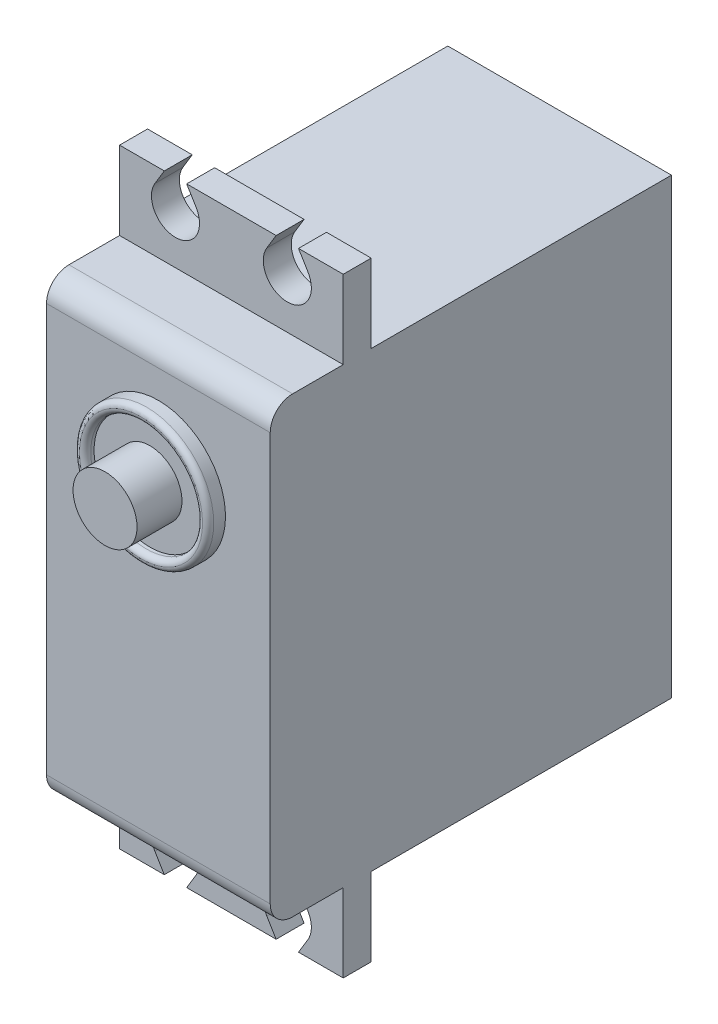
from build123d import *

# Parameters (mm, degrees)
BOSS_EXTRUDE1_DEPTH = 10
SKETCH3_R           = 2.15
CUT_EXTRUDE2_DEPTH  = 2.5
SKETCH2_R           = 6
BOSS_EXTRUDE2_DEPTH = 1.55
CUT_EXTRUDE1_START  = 1.55
CUT_EXTRUDE1_DEPTH  = 0.8
SKETCH2_4_R         = 2.86
BOSS_EXTRUDE3_DEPTH = 4.77
FILLET1_R           = 0.5


with BuildPart() as part:
    # Sketch1 → Boss-Extrude1 (new, symmetric)
    with BuildSketch(Plane(origin=(0, 0, 0), x_dir=(0, 0, -1), z_dir=(1, 0, 0))):
        with BuildLine():
            Line((35.88, -20.25), (35.88, 20.25))
            Line((35.88, 20.25), (9.03, 20.25))
            Line((9.03, 20.25), (9.03, 27.25))
            Line((9.03, 27.25), (6.53, 27.25))
            Line((6.53, 27.25), (6.53, 20.25))
            Line((6.53, 20.25), (2, 20.25))
            ThreePointArc((2, 20.25), (0.585786438, 19.664213562), (0, 18.25))
            Line((0, 18.25), (0, -18.25))
            ThreePointArc((0, -18.25), (0.585786438, -19.664213562), (2, -20.25))
            Line((2, -20.25), (6.53, -20.25))
            Line((6.53, -20.25), (6.53, -27.25))
            Line((6.53, -27.25), (9.03, -27.25))
            Line((9.03, -27.25), (9.03, -20.25))
            Line((9.03, -20.25), (35.88, -20.25))
        make_face()
    extrude(amount=BOSS_EXTRUDE1_DEPTH, both=True)

    # Sketch3 → Cut-Extrude2 (cut)
    with BuildSketch(Plane.XY.offset(-6.53)):
        with Locations((-5, 24.75)):
            Circle(SKETCH3_R)
        with BuildLine():
            Line((-6, 27.25), (-6.839329825, 25.86326807))
            ThreePointArc((-6.839329825, 25.86326807), (-5, 26.9), (-3.160670175, 25.86326807))
            Line((-3.160670175, 25.86326807), (-4, 27.25))
            Line((-4, 27.25), (-6, 27.25))
        make_face()
        with Locations((5, 24.75)):
            Circle(SKETCH3_R)
        with BuildLine():
            Line((6, 27.25), (4, 27.25))
            Line((4, 27.25), (3.160670175, 25.86326807))
            ThreePointArc((3.160670175, 25.86326807), (5, 26.9), (6.839329825, 25.86326807))
            Line((6.839329825, 25.86326807), (6, 27.25))
        make_face()
    cut_extrude2 = extrude(amount=-CUT_EXTRUDE2_DEPTH, mode=Mode.SUBTRACT)

    # Sketch2 → Boss-Extrude2 (add)
    with BuildSketch(Plane.XY):
        with Locations(Location((0, 9.75, 0), (0, 0, 90))):
            Circle(SKETCH2_R)
    extrude(amount=BOSS_EXTRUDE2_DEPTH)

    # Sketch2<3> → Cut-Extrude1 (cut)
    with BuildSketch(Plane.XY.offset(CUT_EXTRUDE1_START)):
        with BuildLine():
            ThreePointArc((-2.86, 9.75), (0, 12.61), (2.86, 9.75))
            Line((2.86, 9.75), (5, 9.75))
            ThreePointArc((5, 9.75), (0, 14.75), (-5, 9.75))
            Line((-5, 9.75), (-2.86, 9.75))
        make_face()
        with BuildLine():
            Line((5, 9.75), (2.86, 9.75))
            ThreePointArc((2.86, 9.75), (0, 6.89), (-2.86, 9.75))
            Line((-2.86, 9.75), (-5, 9.75))
            ThreePointArc((-5, 9.75), (0, 4.75), (5, 9.75))
        make_face()
        with BuildLine():
            ThreePointArc((-2.86, 9.75), (0, 6.89), (2.86, 9.75))
            Line((2.86, 9.75), (-2.86, 9.75))
        make_face()
        with BuildLine():
            Line((-2.86, 9.75), (2.86, 9.75))
            ThreePointArc((2.86, 9.75), (0, 12.61), (-2.86, 9.75))
        make_face()
    extrude(amount=-CUT_EXTRUDE1_DEPTH, mode=Mode.SUBTRACT)

    # Sketch2<4> → Boss-Extrude3 (add)
    with BuildSketch(Plane.XY):
        with Locations((0, 9.75)):
            Circle(SKETCH2_4_R)
    extrude(amount=BOSS_EXTRUDE3_DEPTH)

    # Mirror1: Cut-Extrude2 across plane
    add(cut_extrude2.mirror(Plane.ZX), mode=Mode.SUBTRACT)

    # Fillet1
    fillet1_edges = [part.edges().sort_by_distance(p)[0] for p in [
        (0, 3.75, 1.55),
        (5, 9.75, 1.55),
    ]]
    fillet(fillet1_edges, radius=FILLET1_R - 0.0001)  # a hair under: the kernel refuses the full size


solid = part.part
